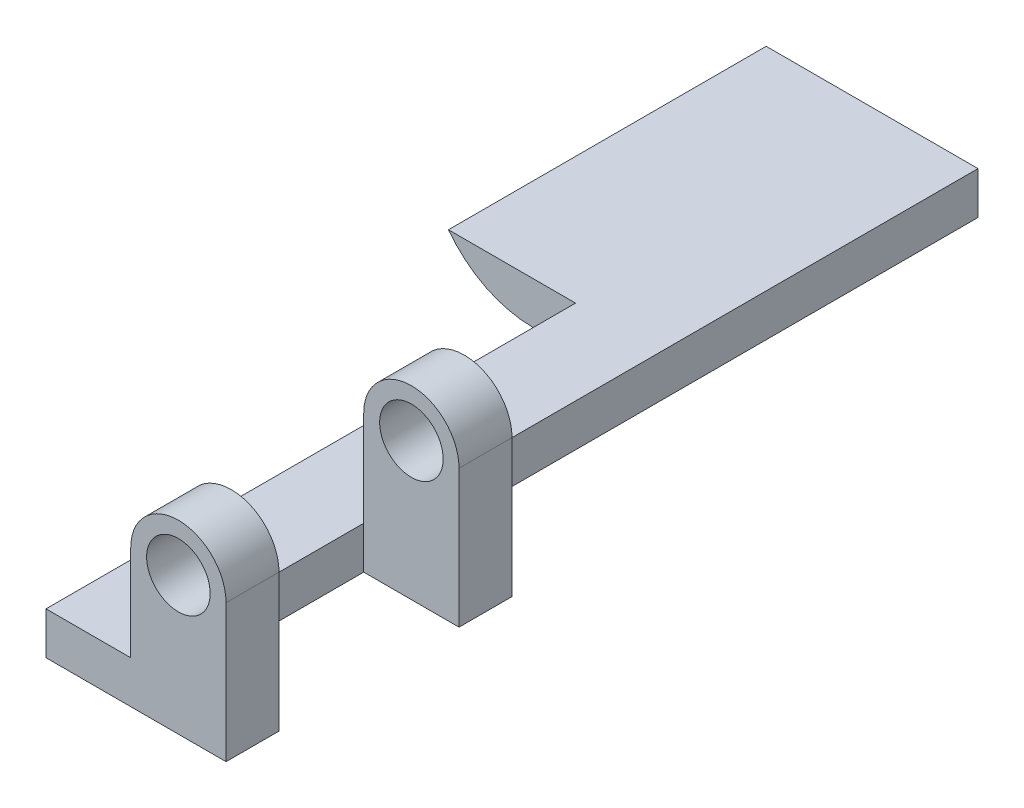
from build123d import *

# Parameters (mm, degrees)
SKETCH1_W           = 8
SKETCH1_H           = 4
SKETCH1_R           = 3
BOSS_EXTRUDE1_DEPTH = 37
SKETCH3_W           = 8
SKETCH3_H           = 4
BOSS_EXTRUDE2_DEPTH = 13
SKETCH4_W           = 20
SKETCH4_H           = 4
BOSS_EXTRUDE3_DEPTH = 30
FILLET1_R           = 10
SKETCH5_W           = 9
SKETCH5_H           = 10
SKETCH5_H_2         = 17
CUT_EXTRUDE1_DEPTH  = 19


with BuildPart() as part:
    # Sketch1 → Boss-Extrude1 (new body)
    # profile 1 of 2: a face of its own
    with BuildSketch(Plane.XY):
        with Locations((37.629567615, 21.902115813)):
            Rectangle(SKETCH1_W, SKETCH1_H)
    # profile 2 of 2: a face of its own
    with BuildSketch(Plane.XY):
        with BuildLine():
            ThreePointArc((41.629567615, 32.902115813), (46.129567615, 37.402115813), (50.629567615, 32.902115813))
            Line((50.629567615, 32.902115813), (50.629567615, 19.902115813))
            Line((50.629567615, 19.902115813), (41.629567615, 19.902115813))
            Line((41.629567615, 19.902115813), (41.629567615, 23.902115813))
            Line((41.629567615, 23.902115813), (41.629567615, 32.902115813))
        make_face()
        with Locations((46.129567615, 32.902115813)):
            Circle(SKETCH1_R, mode=Mode.SUBTRACT)
    extrude(amount=BOSS_EXTRUDE1_DEPTH)

    # Sketch3 → Boss-Extrude2 (add)
    with BuildSketch(Plane(origin=(0, 0, 0), x_dir=(-1, 0, 0), z_dir=(0, 0, -1))):
        with Locations((-37.629567615, 21.902115813)):
            Rectangle(SKETCH3_W, SKETCH3_H)
    extrude(amount=BOSS_EXTRUDE2_DEPTH)

    # Sketch4 → Boss-Extrude3 (add)
    with BuildSketch(Plane(origin=(0, 0, -13), x_dir=(-1, 0, 0), z_dir=(0, 0, -1))):
        with Locations((-31.629567615, 21.902115813)):
            Rectangle(SKETCH4_W, SKETCH4_H)
    extrude(amount=BOSS_EXTRUDE3_DEPTH)

    # Fillet1
    # the kernel refuses this fillet: 10 mm, written as the material it takes off along each edge
    with BuildSketch(Plane(origin=(21.629567615, 19.902115813, 7), x_dir=(1, 0, 0), z_dir=(0, 0, -1))) as fillet1_piece_1:
        with BuildLine():
            CenterArc((8, -10), FILLET1_R, 90, 53.130102354)
            Line((0, -4), (-0.16, -3.88))
            ThreePointArc((-0.16, -3.88), (-0.2, -2), (-0.2, 0))
            Line((-0.2, 0), (0, 0.2))
            Line((0, 0.2), (8, 0.2))
            Line((8, 0.2), (8, 0))
        make_face()
    extrude(amount=70, mode=Mode.SUBTRACT)

    # Sketch5 → Cut-Extrude1 (cut)
    with BuildSketch(Plane(origin=(0, 19.902115813, 0), x_dir=(-1, 0, 0), z_dir=(0, -1, 0))):
        with Locations((-46.129567615, -5)):
            Rectangle(SKETCH5_W, SKETCH5_H)
        with Locations((-46.129567615, -23.5)):
            Rectangle(SKETCH5_W, SKETCH5_H_2)
    extrude(amount=-CUT_EXTRUDE1_DEPTH, mode=Mode.SUBTRACT)


solid = part.part
